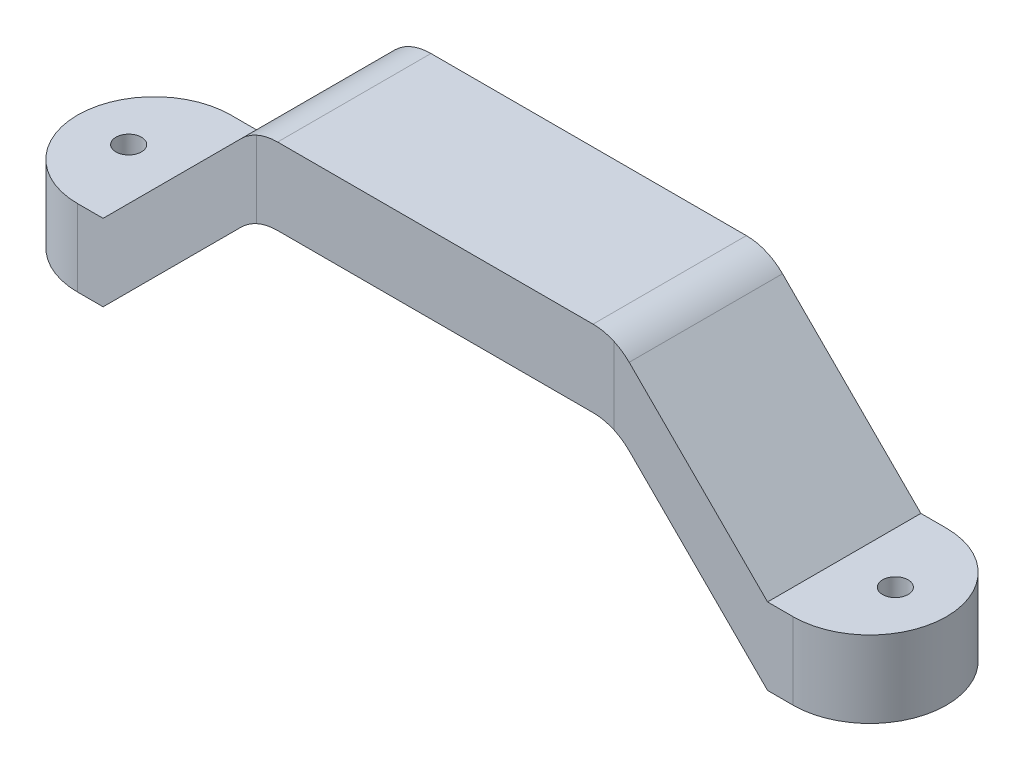
from build123d import *

# Parameters (mm, degrees)
SWEEP1_START        = -19.05
SWEEP1_DEPTH        = 38.1
BOSS_EXTRUDE1_START = -9.525
SKETCH4_R           = 3.175
BOSS_EXTRUDE1_DEPTH = 19.05
FILLET1_R           = 12.7


# Read off the part's stored shape, not the designer's step: Sweep1
with BuildPart() as part:
    # Sweep1 outline → Sweep1 (new body)
    with BuildSketch(Plane.XY.offset(SWEEP1_START)):
        Polygon((82.55, 28.575), (82.55, 47.625), (38.1, 47.625), (0, 9.525), (0, -9.525), (38.1, 28.575), align=None)
    extrude(amount=SWEEP1_DEPTH)

    # Sketch4 → Boss-Extrude1 (add)
    with BuildSketch(Plane(origin=(0, 0, 0), x_dir=(1, 0, 0), z_dir=(0, 1, 0)).offset(BOSS_EXTRUDE1_START)):
        with BuildLine():
            Line((0, 19.05), (-6.35, 19.05))
            ThreePointArc((-6.35, 19.05), (-25.4, 0), (-6.35, -19.05))
            Line((-6.35, -19.05), (0, -19.05))
            Line((0, -19.05), (0, 19.05))
        make_face()
        with Locations(Location((-12.7, 0, 0), (0, 0, 90))):
            Circle(SKETCH4_R, mode=Mode.SUBTRACT)
    extrude(amount=BOSS_EXTRUDE1_DEPTH)

    # Mirror4: part across plane


with BuildPart() as part_1:
    add(part.part)
    add(part.part.mirror(Plane(origin=(82.55, 0, 0), x_dir=(0, 0, 1), z_dir=(1, 0, 0))))

    # Fillet1
    fillet1_edges = [part_1.edges().sort_by_distance(p)[0] for p in [
        (38.1, 47.625, 0),
        (38.1, 28.575, 0),
        (127, 47.625, 0),
        (127, 28.575, 0),
    ]]
    fillet(fillet1_edges, radius=FILLET1_R)


solid = part_1.part
